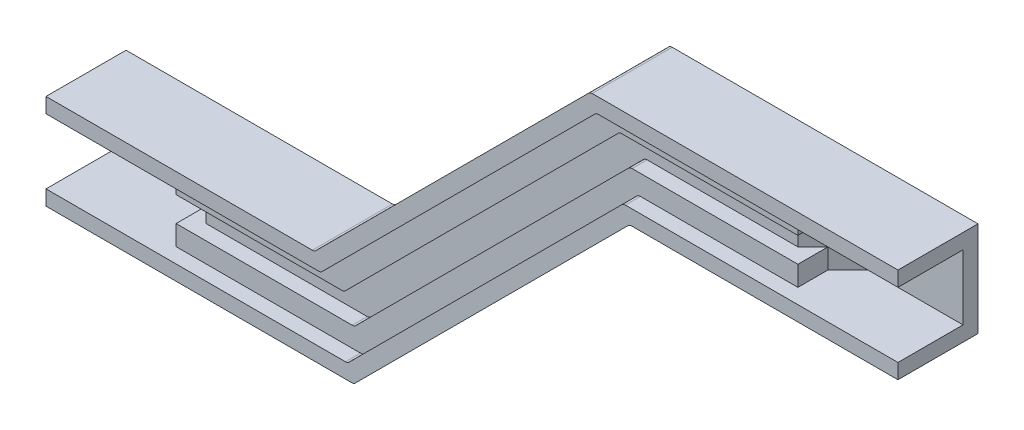
from build123d import *

# Parameters (mm, degrees)
SKETCH_10_R     = 1.65
EXTRUDE_1_DEPTH = 3
EXTRUDE_START   = 3
EXTRUDE_2_DEPTH = 7
EXTRUDE_3_DEPTH = 13
CHAMFER_1_SIZE  = 7
EXTRUDE_5_DEPTH = 10
FILLET_1_R      = 1


with BuildPart() as part:
    # 草图10 → 凸台-拉伸1 (new body)
    with BuildSketch(Plane.XY):
        Polygon((-85.15, -18.05), (-31.485028843, -18.05), (23.614971157, 37.05), (85.15, 37.05), (85.15, 18.05), (31.485028843, 18.05), (-23.614971157, -37.05), (-85.15, -37.05), align=None)
        with Locations((-75.15, -27.55)):
            Circle(SKETCH_10_R, mode=Mode.SUBTRACT)
        with Locations((75.15, 27.55)):
            Circle(SKETCH_10_R, mode=Mode.SUBTRACT)
    extrude(amount=EXTRUDE_1_DEPTH)

    # 草图11 → 凸台-拉伸2 (add)
    with BuildSketch(Plane.XY.offset(EXTRUDE_START)):
        Polygon((-66.15, -18.05), (-66.15, -37.05), (-23.614971157, -37.05), (31.485028843, 18.05), (66.15, 18.05), (66.15, 37.05), (23.614971157, 37.05), (-31.485028843, -18.05), align=None)
    extrude(amount=EXTRUDE_2_DEPTH)

    # 草图12 → 凸台-拉伸3 (add)
    with BuildSketch(Plane.XY.offset(EXTRUDE_START)):
        Polygon((-85.15, -18.05), (-31.485028843, -18.05), (23.614971157, 37.05), (85.15, 37.05), (85.15, 34.05), (24.857611845, 34.05), (-30.242388155, -21.05), (-85.15, -21.05), align=None)
        Polygon((-85.15, -34.05), (-85.15, -37.05), (-23.614971157, -37.05), (31.485028843, 18.05), (85.15, 18.05), (85.15, 21.05), (30.242388155, 21.05), (-24.857611845, -34.05), align=None)
    extrude(amount=EXTRUDE_3_DEPTH)

    # 倒角1
    chamfer_1_edges = [part.edges().sort_by_distance(p)[0] for p in [
        (66.15, 27.55, 10),
        (-66.15, -27.55, 10),
    ]]
    chamfer(chamfer_1_edges, length=CHAMFER_1_SIZE - 0.0001)  # a hair under: the kernel refuses the full size

    # 草图15 → 凸台-拉伸5 (add)
    with BuildSketch(Plane.XY.offset(3)):
        Polygon((-62.15, -21.05), (-62.15, -25.05), (-28.585533906, -25.05), (26.514466094, 30.05), (62.15, 30.05), (62.15, 34.05), (24.857611845, 34.05), (-30.242388155, -21.05), align=None)
        Polygon((-62.15, -30.05), (-62.15, -34.05), (-24.857611845, -34.05), (30.242388155, 21.05), (62.15, 21.05), (62.15, 25.05), (28.585533906, 25.05), (-26.514466094, -30.05), align=None)
    extrude(amount=EXTRUDE_5_DEPTH)

    # 圆角1
    fillet_1_edges = [part.edges().sort_by_distance(p)[0] for p in [
        (-31.485028843, -18.05, 8),
        (23.614971157, 37.05, 8),
        (31.485028843, 18.05, 8),
        (-23.614971157, -37.05, 8),
        (-28.585533906, -25.05, 11.5),
        (26.514466094, 30.05, 11.5),
        (-26.514466094, -30.05, 11.5),
        (28.585533906, 25.05, 11.5),
        (24.857611845, 34.05, 14.5),
        (-30.242388155, -21.05, 14.5),
        (-24.857611845, -34.05, 14.5),
        (30.242388155, 21.05, 14.5),
    ]]
    fillet(fillet_1_edges, radius=FILLET_1_R)


solid = part.part
